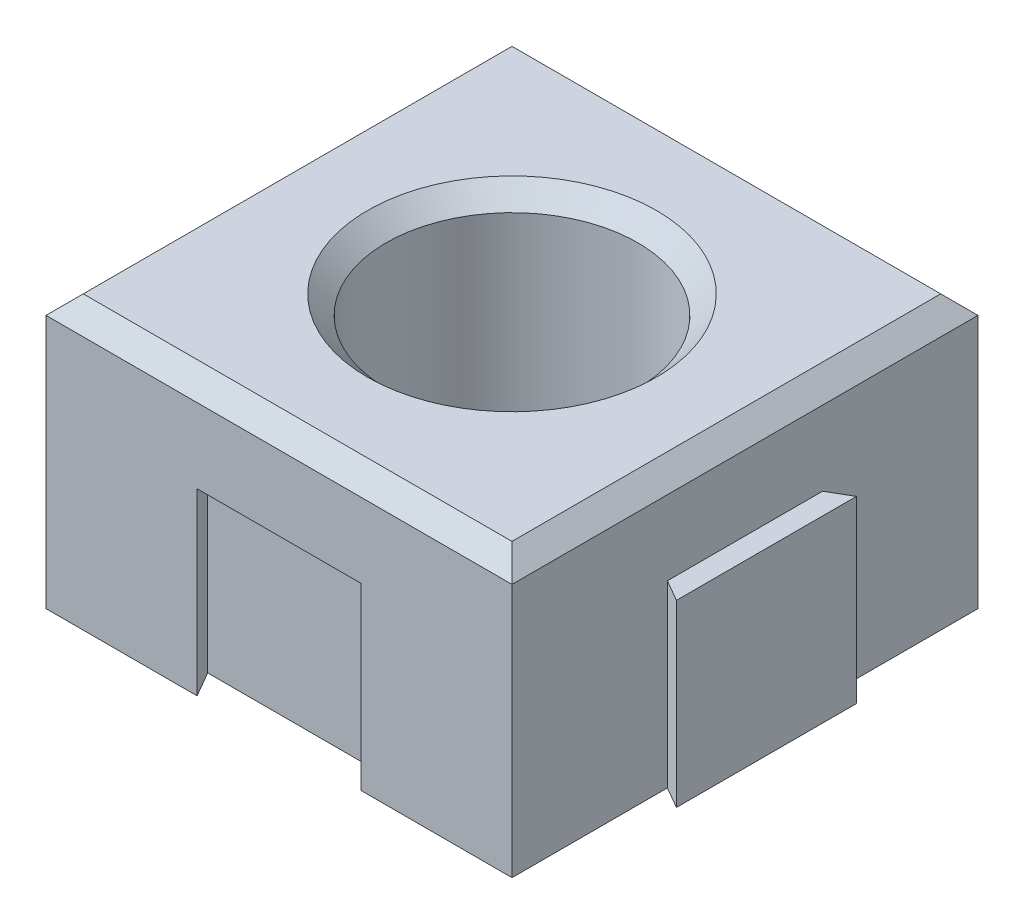
from build123d import *

# Parameters (mm, degrees)
SKETCH1_W           = 50
SKETCH1_H           = 50
BOSS_EXTRUDE1_DEPTH = 30
SKETCH2_R           = 13.5
CUT_EXTRUDE1_DEPTH  = 26
BOSS_EXTRUDE2_DEPTH = 20
BOSS_EXTRUDE3_DEPTH = 20
CUT_EXTRUDE5_DEPTH  = 20
CUT_EXTRUDE6_DEPTH  = 20
CHAMFER1_SIZE       = 2
SKETCH4_R           = 3.1
CUT_EXTRUDE4_DEPTH  = 4
CHAMFER2_SIZE       = 1
CHAMFER3_SIZE       = 0.75


with BuildPart() as part:
    # Sketch1 → Boss-Extrude1 (new body)
    with BuildSketch(Plane(origin=(0, 0, 0), x_dir=(1, 0, 0), z_dir=(0, 1, 0))):
        with Locations((25, 25)):
            Rectangle(SKETCH1_W, SKETCH1_H)
    extrude(amount=BOSS_EXTRUDE1_DEPTH)

    # Sketch2 → Cut-Extrude1 (cut)
    with BuildSketch(Plane(origin=(0, 30, 0), x_dir=(1, 0, 0), z_dir=(0, 1, 0))):
        with Locations((25, 25)):
            Circle(SKETCH2_R)
    extrude(amount=-CUT_EXTRUDE1_DEPTH, mode=Mode.SUBTRACT)

    # Sketch3 → Boss-Extrude2 (add)
    with BuildSketch(Plane(origin=(0, 0, 0), x_dir=(1, 0, 0), z_dir=(0, 1, 0))):
        Polygon((50, 16.674315781), (50, 33.325684219), (52.3, 34.653589838), (52.3, 15.346410162), align=None)
    extrude(amount=BOSS_EXTRUDE2_DEPTH)

    # Sketch3<3> → Boss-Extrude3 (add)
    with BuildSketch(Plane(origin=(0, 0, 0), x_dir=(1, 0, 0), z_dir=(0, 1, 0))):
        Polygon((33.325684219, 50), (16.674315781, 50), (15.346410162, 52.3), (34.653589838, 52.3), align=None)
    extrude(amount=BOSS_EXTRUDE3_DEPTH)

    # Sketch3<6> → Cut-Extrude5 (cut)
    with BuildSketch(Plane(origin=(0, 0, 0), x_dir=(1, 0, 0), z_dir=(0, 1, 0))):
        Polygon((0, 33.787564435), (2.7, 35.346410162), (2.7, 14.653589838), (0, 16.212435565), align=None)
    extrude(amount=CUT_EXTRUDE5_DEPTH, mode=Mode.SUBTRACT)

    # Sketch3<7> → Cut-Extrude6 (cut)
    with BuildSketch(Plane(origin=(0, 0, 0), x_dir=(1, 0, 0), z_dir=(0, 1, 0))):
        Polygon((16.212435565, 0), (14.653589838, 2.7), (35.346410162, 2.7), (33.787564435, 0), align=None)
    extrude(amount=CUT_EXTRUDE6_DEPTH, mode=Mode.SUBTRACT)

    # Chamfer1
    chamfer1_edges = [part.edges().sort_by_distance(p)[0] for p in [
        (25, 30, -50),
        (50, 30, -25),
        (25, 30, 0),
        (0, 30, -25),
        (11.5, 30, -25),
    ]]
    chamfer(chamfer1_edges, length=CHAMFER1_SIZE)

    # Sketch4 → Cut-Extrude4 (cut)
    with BuildSketch(Plane(origin=(0, 0, 0), x_dir=(1, 0, 0), z_dir=(0, 1, 0))):
        with Locations((12.5, 37.5)):
            Circle(SKETCH4_R)
        with Locations((37.5, 37.5)):
            Circle(SKETCH4_R)
        with Locations((37.5, 12.5)):
            Circle(SKETCH4_R)
        with Locations((12.5, 12.5)):
            Circle(SKETCH4_R)
    extrude(amount=CUT_EXTRUDE4_DEPTH, mode=Mode.SUBTRACT)

    # Chamfer2
    chamfer2_edges = [part.edges().sort_by_distance(p)[0] for p in [
        (34.4, 4, -12.5),
        (9.4, 4, -12.5),
        (9.4, 4, -37.5),
        (34.4, 4, -37.5),
    ]]
    chamfer(chamfer2_edges, length=CHAMFER2_SIZE)

    # Chamfer3
    chamfer3_edges = [part.edges().sort_by_distance(p)[0] for p in [
        (41.893782217, 0, 0),
        (50, 0, -8.33715789),
        (50, 0, -41.66284211),
        (41.66284211, 0, -50),
        (8.33715789, 0, -50),
        (0, 0, -41.893782217),
        (0, 0, -8.106217783),
        (8.106217783, 0, 0),
        (9.4, 0, -37.5),
        (34.4, 0, -37.5),
        (34.4, 0, -12.5),
        (9.4, 0, -12.5),
        (51.15, 0, -16.010362971),
        (52.3, 0, -25),
        (51.15, 0, -33.989637029),
        (33.989637029, 0, -51.15),
        (25, 0, -52.3),
        (16.010362971, 0, -51.15),
        (1.35, 0, -34.566987298),
        (2.7, 0, -25),
        (1.35, 0, -15.433012702),
        (15.433012702, 0, -1.35),
        (25, 0, -2.7),
        (34.566987298, 0, -1.35),
    ]]
    chamfer(chamfer3_edges, length=CHAMFER3_SIZE)


solid = part.part
